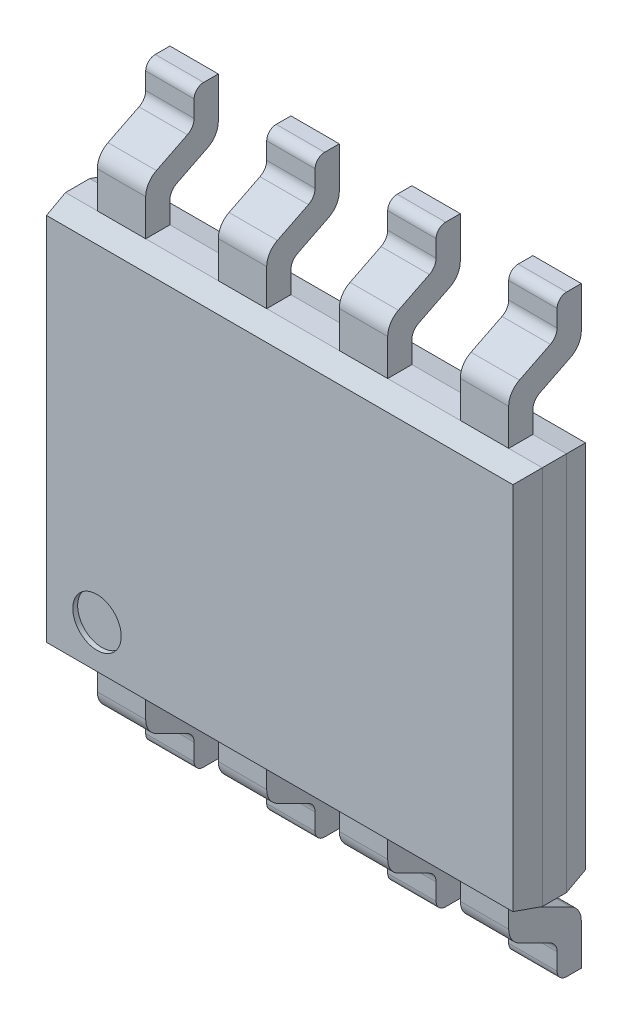
from build123d import *

# Parameters (mm, degrees)
SKETCH1_W            = 0.8128
SKETCH1_H            = 0.508
BASE_EXTRUDE_DEPTH   = 0.254
SKETCH6_W            = 0.4572
SKETCH6_H            = 0.508
BOSS_EXTRUDE1_DEPTH  = 0.508
CHAMFER1_SIZE        = 0.508
CHAMFER1_SIZE_2      = 0.254
CHAMFER2_SIZE        = 0.254
CHAMFER2_SIZE2       = 0.508
SKETCH12_W           = 0.508
SKETCH12_H           = 0.254
BOSS_EXTRUDE6_DEPTH  = 0.3048
SKETCH13_W           = 5.0038
SKETCH13_H           = 0.762
BOSS_EXTRUDE7_DEPTH  = 3.9878
FILLET3_R            = 0.127
FILLET4_R            = 0.2032
LPATTERN5_START      = 1.019206572
LPATTERN5_DEPTH      = 0.508
LPATTERN5_START_2    = 2.289206572
LPATTERN5_2_DEPTH    = 0.508
LPATTERN5_START_3    = 3.559206572
LPATTERN5_3_DEPTH    = 0.508
MIRROR22_START       = -0.250793428
MIRROR22_DEPTH       = 0.508
MIRROR22_START_2     = 1.019206572
MIRROR22_2_DEPTH     = 0.508
MIRROR22_START_3     = 2.289206572
MIRROR22_3_DEPTH     = 0.508
MIRROR22_START_4     = 3.559206572
MIRROR22_4_DEPTH     = 0.508
MIRROR22_START_5     = -0.5842
MIRROR22_5_OUTLINE_W = 0.000876316
MIRROR22_5_OUTLINE_H = 0.762
MIRROR22_5_DEPTH     = 5.0038
CHAMFER3_SIZE        = 0.254
CHAMFER3_SIZE_2      = 0.053989367
SKETCH14_R           = 0.254
CUT_EXTRUDE1_DEPTH   = 0.0508
SCALE1_SCALE         = 5
FILLET5_R            = 0.500000016


# Read off the part's stored shape, not the designer's step: LPattern5, Mirror22
with BuildPart() as part:
    # Sketch1 → Base-Extrude (new body)
    with BuildSketch(Plane(origin=(0.003206572, 0.159581842, 0), x_dir=(0, -1, 0), z_dir=(0, 0, 1))):
        with Locations((0.1016, 0)):
            Rectangle(SKETCH1_W, SKETCH1_H)
    extrude(amount=BASE_EXTRUDE_DEPTH)

    # Sketch6 → Boss-Extrude1 (add)
    with BuildSketch(Plane(origin=(0.003206572, -0.043618158, 0.254), x_dir=(0, 1, 0), z_dir=(0, 0, 1))):
        with Locations((0.2794, 0)):
            Rectangle(SKETCH6_W, SKETCH6_H)
    extrude(amount=BOSS_EXTRUDE1_DEPTH)

    # Chamfer1
    # the kernel refuses this chamfer: 0.508, 0.254 mm, written as the material it takes off along each edge
    with BuildSketch(Plane(origin=(1.572839639, 0.007181842, 0.762), x_dir=(0, -0.017268075123668125, -0.9998508956747116), z_dir=(-1, 0, 0))) as chamfer1_piece_1_section:
        Polygon((CHAMFER1_SIZE * 0.999850895675, -CHAMFER1_SIZE * 0.0172680751237), (-CHAMFER1_SIZE_2 * 0.0172680751237, -CHAMFER1_SIZE_2 * 0.999850895675), (0, 0), align=None)
    chamfer1_piece_1 = extrude(amount=3.139266136, mode=Mode.PRIVATE)
    chamfer1_piece_1 = split(chamfer1_piece_1, bisect_by=Plane(origin=(0.003206572, 0.088077409, 0.254), z_dir=(0, 0, 1)), keep=Keep.TOP, mode=Mode.PRIVATE)
    add(chamfer1_piece_1, mode=Mode.SUBTRACT)

    # Chamfer2
    chamfer2_edges = [part.edges().sort_by_distance(p)[0] for p in [
        (0.003206572, 0.464381842, 0),
    ]]
    chamfer2_side = [part.faces().sort_by_distance(p)[0] for p in [
        (0.003206572, 0.057981842, 0),
    ]]
    chamfer(chamfer2_edges, length=CHAMFER2_SIZE, length2=CHAMFER2_SIZE2, reference=chamfer2_side[0])

    # Sketch12 → Boss-Extrude6 (add)
    with BuildSketch(Plane(origin=(0, 0.464381842, 0), x_dir=(-1, 0, 0), z_dir=(0, 1, 0))):
        with Locations((-0.003206572, 0.635)):
            Rectangle(SKETCH12_W, SKETCH12_H)
    extrude(amount=BOSS_EXTRUDE6_DEPTH)

    # Sketch13 → Boss-Extrude7 (add)
    with BuildSketch(Plane(origin=(0, 0.769181842, 0), x_dir=(-1, 0, 0), z_dir=(0, 1, 0))):
        with Locations((-1.9177, 0.635)):
            Rectangle(SKETCH13_W, SKETCH13_H)
    extrude(amount=BOSS_EXTRUDE7_DEPTH)

    # Fillet3
    fillet3_edges = [part.edges().sort_by_distance(p)[0] for p in [
        (0.003206572, 0.007181842, 0.254),
        (0.003206572, 0.464381842, 0.508),
    ]]
    fillet(fillet3_edges, radius=FILLET3_R)

    # Fillet4
    fillet4_edges = [part.edges().sort_by_distance(p)[0] for p in [
        (0.003206572, 0.261181842, 0.762),
        (0.003206572, 0.210381842, 0),
    ]]
    fillet(fillet4_edges, radius=FILLET4_R)

    # LPattern5 outline → LPattern5 (add)
    with BuildSketch(Plane.YZ.offset(LPATTERN5_START)):
        with BuildLine():
            Line((-0.348418158, 0.254), (-0.348418158, 0))
            Line((-0.348418158, 0), (0.084797335, 0))
            ThreePointArc((0.084797335, 0), (0.191625897, 0.030347756), (0.26654494, 0.112326197))
            Line((0.26654494, 0.112326197), (0.429279905, 0.437796127))
            ThreePointArc((0.429279905, 0.437796127), (0.476104307, 0.489032653), (0.542872158, 0.508))
            Line((0.542872158, 0.508), (0.769181842, 0.508))
            Line((0.769181842, 0.508), (0.769181842, 0.762))
            Line((0.769181842, 0.762), (0.386766348, 0.762))
            ThreePointArc((0.386766348, 0.762), (0.279937786, 0.731652244), (0.205018743, 0.649673803))
            Line((0.205018743, 0.649673803), (0.042283778, 0.324203873))
            ThreePointArc((0.042283778, 0.324203873), (-0.004540624, 0.272967347), (-0.071308475, 0.254))
            Line((-0.071308475, 0.254), (-0.348418158, 0.254))
        make_face()
    extrude(amount=LPATTERN5_DEPTH)

    # LPattern5 2 outline → LPattern5 2 (add)
    with BuildSketch(Plane.YZ.offset(LPATTERN5_START_2)):
        with BuildLine():
            Line((-0.348418158, 0.254), (-0.348418158, 0))
            Line((-0.348418158, 0), (0.084797335, 0))
            ThreePointArc((0.084797335, 0), (0.191625897, 0.030347756), (0.26654494, 0.112326197))
            Line((0.26654494, 0.112326197), (0.429279905, 0.437796127))
            ThreePointArc((0.429279905, 0.437796127), (0.476104307, 0.489032653), (0.542872158, 0.508))
            Line((0.542872158, 0.508), (0.769181842, 0.508))
            Line((0.769181842, 0.508), (0.769181842, 0.762))
            Line((0.769181842, 0.762), (0.386766348, 0.762))
            ThreePointArc((0.386766348, 0.762), (0.279937786, 0.731652244), (0.205018743, 0.649673803))
            Line((0.205018743, 0.649673803), (0.042283778, 0.324203873))
            ThreePointArc((0.042283778, 0.324203873), (-0.004540624, 0.272967347), (-0.071308475, 0.254))
            Line((-0.071308475, 0.254), (-0.348418158, 0.254))
        make_face()
    extrude(amount=LPATTERN5_2_DEPTH)

    # LPattern5 3 outline → LPattern5 3 (add)
    with BuildSketch(Plane.YZ.offset(LPATTERN5_START_3)):
        with BuildLine():
            Line((-0.348418158, 0.254), (-0.348418158, 0))
            Line((-0.348418158, 0), (0.084797335, 0))
            ThreePointArc((0.084797335, 0), (0.191625897, 0.030347756), (0.26654494, 0.112326197))
            Line((0.26654494, 0.112326197), (0.429279905, 0.437796127))
            ThreePointArc((0.429279905, 0.437796127), (0.476104307, 0.489032653), (0.542872158, 0.508))
            Line((0.542872158, 0.508), (0.769181842, 0.508))
            Line((0.769181842, 0.508), (0.769181842, 0.762))
            Line((0.769181842, 0.762), (0.386766348, 0.762))
            ThreePointArc((0.386766348, 0.762), (0.279937786, 0.731652244), (0.205018743, 0.649673803))
            Line((0.205018743, 0.649673803), (0.042283778, 0.324203873))
            ThreePointArc((0.042283778, 0.324203873), (-0.004540624, 0.272967347), (-0.071308475, 0.254))
            Line((-0.071308475, 0.254), (-0.348418158, 0.254))
        make_face()
    extrude(amount=LPATTERN5_3_DEPTH)

    # Mirror22 outline → Mirror22 (add)
    with BuildSketch(Plane.YZ.offset(MIRROR22_START)):
        with BuildLine():
            Line((4.756981842, 0.254), (4.757858158, 0.254))
            Line((4.757858158, 0.254), (4.757858158, 0.508))
            Line((4.757858158, 0.508), (4.984167842, 0.508))
            ThreePointArc((4.984167842, 0.508), (5.050935693, 0.489032653), (5.097760095, 0.437796127))
            Line((5.097760095, 0.437796127), (5.26049506, 0.112326197))
            ThreePointArc((5.26049506, 0.112326197), (5.335414103, 0.030347756), (5.442242665, 0))
            Line((5.442242665, 0), (5.875458158, 0))
            Line((5.875458158, 0), (5.875458158, 0.254))
            Line((5.875458158, 0.254), (5.598348475, 0.254))
            ThreePointArc((5.598348475, 0.254), (5.531580624, 0.272967347), (5.484756222, 0.324203873))
            Line((5.484756222, 0.324203873), (5.322021257, 0.649673803))
            ThreePointArc((5.322021257, 0.649673803), (5.247102214, 0.731652244), (5.140273652, 0.762))
            Line((5.140273652, 0.762), (4.757858158, 0.762))
            Line((4.757858158, 0.762), (4.757858158, 1.016))
            Line((4.757858158, 1.016), (4.756981842, 1.016))
            Line((4.756981842, 1.016), (4.756981842, 0.254))
        make_face()
    extrude(amount=MIRROR22_DEPTH)

    # Mirror22 2 outline → Mirror22 2 (add)
    with BuildSketch(Plane.YZ.offset(MIRROR22_START_2)):
        with BuildLine():
            Line((4.756981842, 0.254), (4.757858158, 0.254))
            Line((4.757858158, 0.254), (4.757858158, 0.508))
            Line((4.757858158, 0.508), (4.984167842, 0.508))
            ThreePointArc((4.984167842, 0.508), (5.050935693, 0.489032653), (5.097760095, 0.437796127))
            Line((5.097760095, 0.437796127), (5.26049506, 0.112326197))
            ThreePointArc((5.26049506, 0.112326197), (5.335414103, 0.030347756), (5.442242665, 0))
            Line((5.442242665, 0), (5.875458158, 0))
            Line((5.875458158, 0), (5.875458158, 0.254))
            Line((5.875458158, 0.254), (5.598348475, 0.254))
            ThreePointArc((5.598348475, 0.254), (5.531580624, 0.272967347), (5.484756222, 0.324203873))
            Line((5.484756222, 0.324203873), (5.322021257, 0.649673803))
            ThreePointArc((5.322021257, 0.649673803), (5.247102214, 0.731652244), (5.140273652, 0.762))
            Line((5.140273652, 0.762), (4.757858158, 0.762))
            Line((4.757858158, 0.762), (4.757858158, 1.016))
            Line((4.757858158, 1.016), (4.756981842, 1.016))
            Line((4.756981842, 1.016), (4.756981842, 0.254))
        make_face()
    extrude(amount=MIRROR22_2_DEPTH)

    # Mirror22 3 outline → Mirror22 3 (add)
    with BuildSketch(Plane.YZ.offset(MIRROR22_START_3)):
        with BuildLine():
            Line((4.756981842, 0.254), (4.757858158, 0.254))
            Line((4.757858158, 0.254), (4.757858158, 0.508))
            Line((4.757858158, 0.508), (4.984167842, 0.508))
            ThreePointArc((4.984167842, 0.508), (5.050935693, 0.489032653), (5.097760095, 0.437796127))
            Line((5.097760095, 0.437796127), (5.26049506, 0.112326197))
            ThreePointArc((5.26049506, 0.112326197), (5.335414103, 0.030347756), (5.442242665, 0))
            Line((5.442242665, 0), (5.875458158, 0))
            Line((5.875458158, 0), (5.875458158, 0.254))
            Line((5.875458158, 0.254), (5.598348475, 0.254))
            ThreePointArc((5.598348475, 0.254), (5.531580624, 0.272967347), (5.484756222, 0.324203873))
            Line((5.484756222, 0.324203873), (5.322021257, 0.649673803))
            ThreePointArc((5.322021257, 0.649673803), (5.247102214, 0.731652244), (5.140273652, 0.762))
            Line((5.140273652, 0.762), (4.757858158, 0.762))
            Line((4.757858158, 0.762), (4.757858158, 1.016))
            Line((4.757858158, 1.016), (4.756981842, 1.016))
            Line((4.756981842, 1.016), (4.756981842, 0.254))
        make_face()
    extrude(amount=MIRROR22_3_DEPTH)

    # Mirror22 4 outline → Mirror22 4 (add)
    with BuildSketch(Plane.YZ.offset(MIRROR22_START_4)):
        with BuildLine():
            Line((4.756981842, 0.254), (4.757858158, 0.254))
            Line((4.757858158, 0.254), (4.757858158, 0.508))
            Line((4.757858158, 0.508), (4.984167842, 0.508))
            ThreePointArc((4.984167842, 0.508), (5.050935693, 0.489032653), (5.097760095, 0.437796127))
            Line((5.097760095, 0.437796127), (5.26049506, 0.112326197))
            ThreePointArc((5.26049506, 0.112326197), (5.335414103, 0.030347756), (5.442242665, 0))
            Line((5.442242665, 0), (5.875458158, 0))
            Line((5.875458158, 0), (5.875458158, 0.254))
            Line((5.875458158, 0.254), (5.598348475, 0.254))
            ThreePointArc((5.598348475, 0.254), (5.531580624, 0.272967347), (5.484756222, 0.324203873))
            Line((5.484756222, 0.324203873), (5.322021257, 0.649673803))
            ThreePointArc((5.322021257, 0.649673803), (5.247102214, 0.731652244), (5.140273652, 0.762))
            Line((5.140273652, 0.762), (4.757858158, 0.762))
            Line((4.757858158, 0.762), (4.757858158, 1.016))
            Line((4.757858158, 1.016), (4.756981842, 1.016))
            Line((4.756981842, 1.016), (4.756981842, 0.254))
        make_face()
    extrude(amount=MIRROR22_4_DEPTH)

    # Mirror22 5 outline → Mirror22 5 (add)
    with BuildSketch(Plane.YZ.offset(MIRROR22_START_5)):
        with Locations((4.75742, 0.635)):
            Rectangle(MIRROR22_5_OUTLINE_W, MIRROR22_5_OUTLINE_H)
    extrude(amount=MIRROR22_5_DEPTH)

    # Chamfer3
    # the kernel refuses this chamfer: 0.254, 0.053989367 mm, written as the material it takes off along each edge
    with BuildSketch(Plane(origin=(5.079466081, 4.757858158, 1.016), x_dir=(0, 0.008003073799517865, -0.9999679748920758), z_dir=(-1, 0, 0)), Plane(origin=(-1.244066081, 0.769181842, 1.016), x_dir=(0, -0.008003073799517023, -0.9999679748920758), z_dir=(1, 0, 0)), Plane(origin=(5.079466081, 0.769181842, 0.254), x_dir=(0, -0.008003073799517023, 0.9999679748920758), z_dir=(-1, 0, 0))) as chamfer3_piece_1:
        Polygon((CHAMFER3_SIZE * 0.999967974892, CHAMFER3_SIZE * 0.00800307379952), (-CHAMFER3_SIZE_2 * 0.00800307374974, CHAMFER3_SIZE_2 * 0.999967968672), (0, 0), align=None)
    extrude(amount=6.323532163, mode=Mode.SUBTRACT)
    with BuildSketch(Plane(origin=(-1.244066081, 4.757858158, 0.254), x_dir=(0, -0.9846701949274145, -0.17442650951506075), z_dir=(1, 0, 0))) as chamfer3_piece_2:
        Polygon((CHAMFER3_SIZE_2 * 0.984670188803, -CHAMFER3_SIZE_2 * 0.17442650843), (-CHAMFER3_SIZE * 0.174426509515, -CHAMFER3_SIZE * 0.984670194927), (0, 0), align=None)
    extrude(amount=6.323532163, mode=Mode.SUBTRACT)
    with BuildSketch(Plane(origin=(-0.5842, 5.417724239, 0.254), x_dir=(0.9846701949274143, 0, -0.17442650951506142), z_dir=(0, -1, 0)), Plane(origin=(4.4196, 0.10931576, 0.254), x_dir=(-0.9846701949274145, 0, -0.17442650951506075), z_dir=(0, 1, 0))) as chamfer3_piece_3:
        Polygon((CHAMFER3_SIZE_2 * 0.984670188803, CHAMFER3_SIZE_2 * 0.17442650843), (-CHAMFER3_SIZE * 0.174426509515, CHAMFER3_SIZE * 0.984670194927), (0, 0), align=None)
    extrude(amount=5.308408479, mode=Mode.SUBTRACT)
    with BuildSketch(Plane(origin=(-0.5842, 5.417724239, 1.016), x_dir=(-0.008003073799517023, 0, -0.9999679748920758), z_dir=(0, -1, 0)), Plane(origin=(4.4196, 0.10931576, 1.016), x_dir=(0.008003073799517865, 0, -0.9999679748920758), z_dir=(0, 1, 0))) as chamfer3_piece_4:
        Polygon((CHAMFER3_SIZE * 0.999967974892, CHAMFER3_SIZE * 0.00800307379952), (-CHAMFER3_SIZE_2 * 0.00800307374974, CHAMFER3_SIZE_2 * 0.999967968672), (0, 0), align=None)
    extrude(amount=5.308408479, mode=Mode.SUBTRACT)

    # Sketch14 → Cut-Extrude1 (cut)
    with BuildSketch(Plane.XY.offset(1.016)):
        with Locations((0, 1.27)):
            Circle(SKETCH14_R)
    extrude(amount=-CUT_EXTRUDE1_DEPTH, mode=Mode.SUBTRACT)


with BuildPart() as part_1:
    # Scale1: scaled about (1.91799889, 2.764451225, 0.609977057)
    add(part.part.scale(SCALE1_SCALE).moved(Location((-7.67199556, -11.0578049, -2.439908228))))

    # Fillet5
    fillet5_edges = [part_1.edges().sort_by_distance(p)[0] for p in [
        (-7.655962702, -12.799895691, -1.169908228),
        (-1.3059627, -12.79989569, -1.169908228),
        (5.0440373, -12.79989569, -1.169908228),
        (11.3940373, -12.79989569, -1.169908228),
        (-7.6559627, 18.31948589, -1.169908228),
        (-1.3059627, 18.31948589, -1.169908228),
        (5.0440373, 18.31948589, -1.169908228),
        (11.3940373, 18.31948589, -1.169908228),
    ]]
    fillet(fillet5_edges, radius=FILLET5_R)


solid = part_1.part
